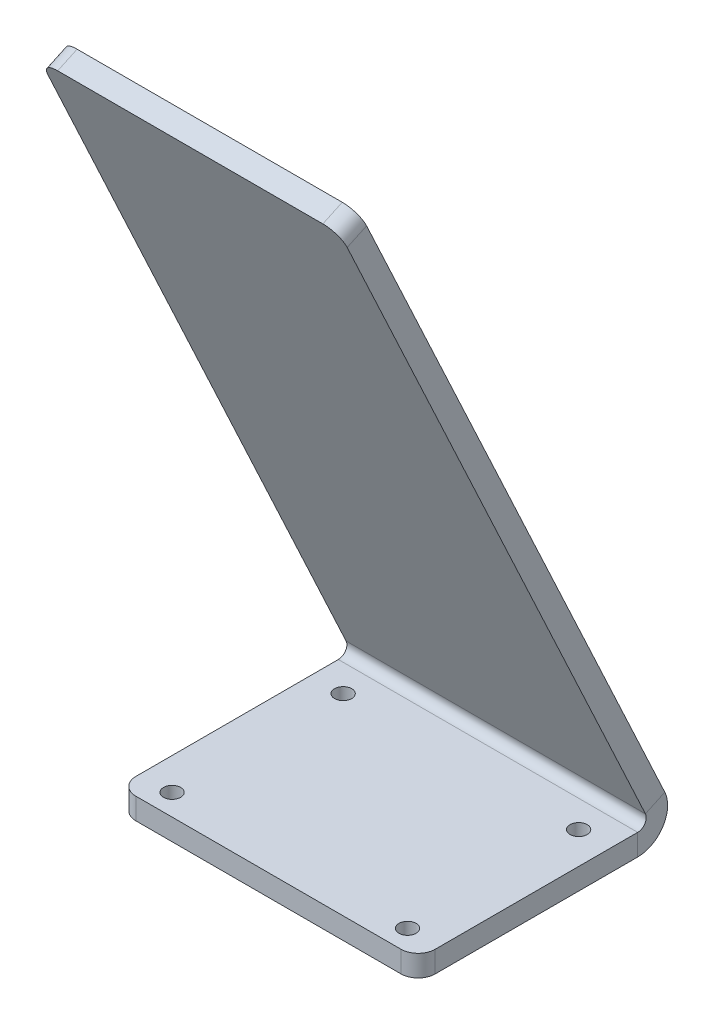
from build123d import *

# Parameters (mm, degrees)
SKETCH1_W                      = 88.9
SKETCH1_H                      = 76.2
BASE_FLANGE1_DEPTH             = 6.35
EDGE_FLANGE1_START             = -44.45
EDGE_FLANGE1_DEPTH             = 88.9
EDGE_FLANGE1_2_DEPTH           = 88.9
F_7_0_201_DIAMETER_HOLE1_D     = 5.1054
F_7_0_201_DIAMETER_HOLE1_DEPTH = 6.35
FILLET1_R                      = 5.08


# Read off the part's stored shape, not the designer's step: Edge-Flange1
# Sheet-metal steps are written as plain solids
with BuildPart() as part:
    # Sketch1 → Base-Flange1 (new body)
    with BuildSketch(Plane(origin=(0, 0, 0), x_dir=(1, 0, 0), z_dir=(0, 1, 0))):
        Rectangle(SKETCH1_W, SKETCH1_H)
    extrude(amount=-BASE_FLANGE1_DEPTH)

    # Edge-Flange1 outline → Edge-Flange1 (cut)
    with BuildSketch(Plane.YZ.offset(EDGE_FLANGE1_START)):
        with BuildLine():
            Line((0, -38.1), (0, -35.625967843))
            ThreePointArc((0, -35.625967843), (-4.587857322, -32.419340017), (-6.35, -27.106548849))
            Line((-6.35, -27.106548849), (-6.35, -38.1))
            Line((-6.35, -38.1), (0, -38.1))
        make_face()
    extrude(amount=EDGE_FLANGE1_DEPTH, mode=Mode.SUBTRACT)

    # Edge-Flange1 2 outline → Edge-Flange1 2 (add)
    with BuildSketch(Plane.YZ.offset(EDGE_FLANGE1_START)):
        with BuildLine():
            ThreePointArc((0, -35.625967843), (3.190967678, -35.972683355), (6.297076347, -35.163625075))
            Line((6.297076347, -35.163625075), (200.831960117, 55.549481005))
            Line((200.831960117, 55.549481005), (198.148334155, 61.304535452))
            Line((198.148334155, 61.304535452), (3.613450385, -29.408570628))
            ThreePointArc((3.613450385, -29.408570628), (1.175258995, -29.248763121), (0, -27.106548849))
            Line((0, -27.106548849), (0, -35.625967843))
        make_face()
    extrude(amount=EDGE_FLANGE1_2_DEPTH)

    # #7 (0.201) Diameter Hole1
    with Locations(Plane(origin=(0, 0, 0), x_dir=(1, 0, 0), z_dir=(0, 1, 0))):
        with Locations((-34.9631, 19.05), (34.9631, 19.05), (34.9631, -31.75), (-34.9631, -31.75)):
            Hole(F_7_0_201_DIAMETER_HOLE1_D / 2, depth=F_7_0_201_DIAMETER_HOLE1_DEPTH)

    # Fillet1
    fillet1_edges = [part.edges().sort_by_distance(p)[0] for p in [
        (44.45, 199.490147136, 58.427008229),
        (-44.45, 199.490147136, 58.427008229),
        (44.45, -3.175, 38.1),
        (-44.45, -3.175, 38.1),
    ]]
    fillet(fillet1_edges, radius=FILLET1_R)


solid = part.part
